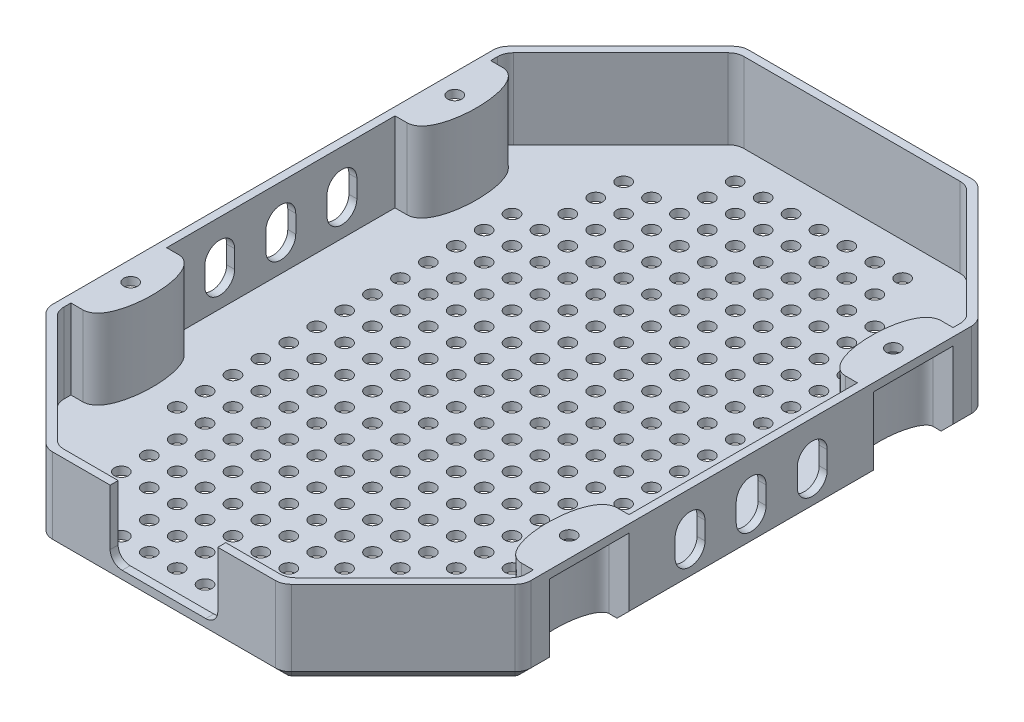
from build123d import *

# Parameters (mm, degrees)
BOSS_EXTRUDE1_DEPTH     = 2
BOSS_EXTRUDE2_DEPTH     = 20
BOSS_EXTRUDE3_DEPTH     = 2
SKETCH4_R               = 1.75
CUT_EXTRUDE1_DEPTH      = 108.810185667
SKETCH5_W               = 13.5
SKETCH5_H               = 2
CUT_EXTRUDE2_DEPTH      = 17
CUT_EXTRUDE3_DEPTH      = 109.199057916
FILLET1_R               = 3
FILLET2_R               = 4
CHAMFER1_SIZE           = 3
FILL_PATTERN1_OUTLINE_R = 1.75
FILL_PATTERN1_DEPTH     = 2


# Read off the part's stored shape, not the designer's step: Fill Pattern1
with BuildPart() as part:
    # Sketch1 → Boss-Extrude1 (new body)
    with BuildSketch(Plane(origin=(0, 0, 0), x_dir=(1, 0, 0), z_dir=(0, 1, 0))):
        with BuildLine():
            Line((55, 30.651951673), (60, 30.651951673))
            Line((60, 30.651951673), (60, -30.651951673))
            Line((60, -30.651951673), (55, -30.651951673))
            add(Edge.make_bspline(
                [(55, -30.651951673), (51.5, -30.651951673), (51.5, -40.651951673), (51.5, -50.651951673), (55, -50.651951673)],
                knots=[3.141592654, 3.141592654, 3.141592654, 4.71238898, 4.71238898, 6.283185307, 6.283185307, 6.283185307], degree=2, weights=[1, 0.707106781, 1, 0.707106781, 1]))
            Line((55, -50.651951673), (60, -50.651951673))
            Line((60, -50.651951673), (60, -56.904408409))
            Line((60, -56.904408409), (29.594408409, -87.31))
            Line((29.594408409, -87.31), (0, -87.31))
            Line((0, -87.31), (0, 87.31))
            Line((0, 87.31), (29.594408409, 87.31))
            Line((29.594408409, 87.31), (60, 56.904408409))
            Line((60, 56.904408409), (60, 50.651951673))
            Line((60, 50.651951673), (55, 50.651951673))
            add(Edge.make_bspline(
                [(55, 50.651951673), (51.5, 50.651951673), (51.5, 40.651951673), (51.5, 30.651951673), (55, 30.651951673)],
                knots=[0, 0, 0, 1.570796327, 1.570796327, 3.141592654, 3.141592654, 3.141592654], degree=2, weights=[1, 0.707106781, 1, 0.707106781, 1]))
        make_face()
    extrude(amount=BOSS_EXTRUDE1_DEPTH)

    # Sketch2 → Boss-Extrude2 (add)
    with BuildSketch(Plane(origin=(0, 2, 0), x_dir=(1, 0, 0), z_dir=(0, 1, 0))):
        with BuildLine():
            Line((29.594408409, 87.31), (0, 87.31))
            Line((0, 87.31), (0, 85.31))
            Line((0, 85.31), (28.765981284, 85.31))
            Line((28.765981284, 85.31), (58, 56.075981284))
            Line((58, 56.075981284), (58, 52.651951673))
            Line((58, 52.651951673), (55, 52.651951673))
            add(Edge.make_bspline(
                [(55, 28.651951673), (54.70222525, 28.651951673), (54.094873807, 28.739043927), (53.042573201, 29.199915612), (52.077202892, 30.084886092), (51.253226578, 31.371465347), (50.612948374, 32.884681085), (50.119437244, 34.610908381), (49.645142322, 37.151780185), (49.403238452, 40.651951673), (49.645142322, 44.152123161), (50.119437244, 46.692994964), (50.612948374, 48.419222261), (51.253226578, 49.932437998), (52.077202892, 51.219017254), (53.042573201, 52.103987733), (54.094873807, 52.564859419), (54.70222525, 52.651951673), (55, 52.651951673)],
                knots=[0, 0, 0, 0, 0.09817477, 0.196349541, 0.392699082, 0.589048623, 0.785398163, 0.981747704, 1.178097245, 1.570796327, 1.963495408, 2.159844949, 2.35619449, 2.552544031, 2.748893572, 2.945243113, 3.043417883, 3.141592654, 3.141592654, 3.141592654, 3.141592654], degree=3))
            Line((55, 28.651951673), (58, 28.651951673))
            Line((58, 28.651951673), (58, -28.651951673))
            Line((58, -28.651951673), (55, -28.651951673))
            add(Edge.make_bspline(
                [(55, -52.651951673), (54.70222525, -52.651951673), (54.094873807, -52.564859419), (53.042573201, -52.103987733), (52.077202892, -51.219017254), (51.253226578, -49.932437998), (50.612948374, -48.419222261), (50.119437244, -46.692994964), (49.645142322, -44.152123161), (49.403238452, -40.651951673), (49.645142322, -37.151780185), (50.119437244, -34.610908381), (50.612948374, -32.884681085), (51.253226578, -31.371465347), (52.077202892, -30.084886092), (53.042573201, -29.199915612), (54.094873807, -28.739043927), (54.70222525, -28.651951673), (55, -28.651951673)],
                knots=[3.141592654, 3.141592654, 3.141592654, 3.141592654, 3.239767424, 3.337942194, 3.534291735, 3.730641276, 3.926990817, 4.123340358, 4.319689899, 4.71238898, 5.105088062, 5.301437603, 5.497787144, 5.694136685, 5.890486225, 6.086835766, 6.185010537, 6.283185307, 6.283185307, 6.283185307, 6.283185307], degree=3))
            Line((55, -52.651951673), (58, -52.651951673))
            Line((58, -52.651951673), (58, -56.075981284))
            Line((58, -56.075981284), (28.765981284, -85.31))
            Line((28.765981284, -85.31), (0, -85.31))
            Line((0, -85.31), (0, -87.31))
            Line((0, -87.31), (29.594408409, -87.31))
            Line((29.594408409, -87.31), (60, -56.904408409))
            Line((60, -56.904408409), (60, -50.651951673))
            Line((60, -50.651951673), (55, -50.651951673))
            add(Edge.make_bspline(
                [(55, -30.651951673), (51.5, -30.651951673), (51.5, -40.651951673), (51.5, -50.651951673), (55, -50.651951673)],
                knots=[3.141592654, 3.141592654, 3.141592654, 4.71238898, 4.71238898, 6.283185307, 6.283185307, 6.283185307], degree=2, weights=[1, 0.707106781, 1, 0.707106781, 1]))
            Line((55, -30.651951673), (60, -30.651951673))
            Line((60, -30.651951673), (60, 30.651951673))
            Line((60, 30.651951673), (55, 30.651951673))
            add(Edge.make_bspline(
                [(55, 50.651951673), (51.5, 50.651951673), (51.5, 40.651951673), (51.5, 30.651951673), (55, 30.651951673)],
                knots=[0, 0, 0, 1.570796327, 1.570796327, 3.141592654, 3.141592654, 3.141592654], degree=2, weights=[1, 0.707106781, 1, 0.707106781, 1]))
            Line((55, 50.651951673), (60, 50.651951673))
            Line((60, 50.651951673), (60, 56.904408409))
            Line((60, 56.904408409), (29.594408409, 87.31))
        make_face()
    extrude(amount=BOSS_EXTRUDE2_DEPTH)

    # Sketch3 → Boss-Extrude3 (add)
    with BuildSketch(Plane(origin=(0, 22, 0), x_dir=(1, 0, 0), z_dir=(0, 1, 0))):
        with BuildLine():
            Line((60, 30.651951673), (55, 30.651951673))
            add(Edge.make_bspline(
                [(55, 50.651951673), (51.5, 50.651951673), (51.5, 40.651951673), (51.5, 30.651951673), (55, 30.651951673)],
                knots=[0, 0, 0, 1.570796327, 1.570796327, 3.141592654, 3.141592654, 3.141592654], degree=2, weights=[1, 0.707106781, 1, 0.707106781, 1]))
            Line((55, 50.651951673), (60, 50.651951673))
            Line((60, 50.651951673), (60, 30.651951673))
        make_face()
        with BuildLine():
            Line((55, -50.651951673), (60, -50.651951673))
            Line((60, -50.651951673), (60, -30.651951673))
            Line((60, -30.651951673), (55, -30.651951673))
            add(Edge.make_bspline(
                [(55, -30.651951673), (51.5, -30.651951673), (51.5, -40.651951673), (51.5, -50.651951673), (55, -50.651951673)],
                knots=[3.141592654, 3.141592654, 3.141592654, 4.71238898, 4.71238898, 6.283185307, 6.283185307, 6.283185307], degree=2, weights=[1, 0.707106781, 1, 0.707106781, 1]))
        make_face()
    extrude(amount=-BOSS_EXTRUDE3_DEPTH)

    # Sketch4 → Cut-Extrude1 (cut, through all)
    with BuildSketch(Plane.XZ.offset(-20)):
        with Locations(Location((55, 40.651951673, 0), (0, 0, 270))):
            Circle(SKETCH4_R)
        with Locations(Location((55, -40.651951673, 0), (0, 0, 90))):
            Circle(SKETCH4_R)
    extrude(amount=-CUT_EXTRUDE1_DEPTH, mode=Mode.SUBTRACT)

    # Sketch5 → Cut-Extrude2 (cut)
    with BuildSketch(Plane(origin=(0, 22, 0), x_dir=(1, 0, 0), z_dir=(0, 1, 0))):
        with Locations((6.75, -86.31)):
            Rectangle(SKETCH5_W, SKETCH5_H)
    extrude(amount=-CUT_EXTRUDE2_DEPTH, mode=Mode.SUBTRACT)

    # Sketch8 → Cut-Extrude3 (cut, through all)
    with BuildSketch(Plane(origin=(60, 0, 0), x_dir=(0, 0, -1), z_dir=(1, 0, 0))):
        with BuildLine():
            Line((-3.75, 8.75), (-3.75, 13.25))
            ThreePointArc((-3.75, 13.25), (0, 17), (3.75, 13.25))
            Line((3.75, 13.25), (3.75, 8.75))
            ThreePointArc((3.75, 8.75), (0, 5), (-3.75, 8.75))
        make_face()
        with BuildLine():
            Line((11.575975836, 8.75), (11.575975836, 13.25))
            ThreePointArc((11.575975836, 13.25), (15.325975836, 17), (19.075975836, 13.25))
            Line((19.075975836, 13.25), (19.075975836, 8.75))
            ThreePointArc((19.075975836, 8.75), (15.325975836, 5), (11.575975836, 8.75))
        make_face()
        with BuildLine():
            Line((-19.075975836, 8.75), (-19.075975836, 13.25))
            ThreePointArc((-19.075975836, 13.25), (-15.325975836, 17), (-11.575975836, 13.25))
            Line((-11.575975836, 13.25), (-11.575975836, 8.75))
            ThreePointArc((-11.575975836, 8.75), (-15.325975836, 5), (-19.075975836, 8.75))
        make_face()
    extrude(amount=-CUT_EXTRUDE3_DEPTH, mode=Mode.SUBTRACT)

    # Fillet1
    fillet1_edges = [part.edges().sort_by_distance(p)[0] for p in [
        (13.5, 5, 86.31),
    ]]
    fillet(fillet1_edges, radius=FILLET1_R)

    # Fillet2
    fillet2_edges = [part.edges().sort_by_distance(p)[0] for p in [
        (60, 11, 56.904408409),
        (29.594408409, 11, 87.31),
        (29.594408409, 11, -87.31),
        (60, 11, -56.904408409),
        (28.765981284, 12, -85.31),
        (58, 12, -56.075981284),
        (58, 12, 56.075981284),
        (28.765981284, 12, 85.31),
    ]]
    fillet(fillet2_edges, radius=FILLET2_R)

    # Chamfer1
    chamfer1_edges = [part.edges().sort_by_distance(p)[0] for p in [
        (60, 0, 0),
        (13.96877708, 0, 87.31),
        (60, 0, -52.949752916),
        (13.96877708, 0, -87.31),
        (60, 0, 52.949752916),
        (44.797204204, 0, 72.107204204),
        (44.797204204, 0, -72.107204204),
        (29.468287889, 0, 87.00551813),
        (59.69551813, 0, 56.778287889),
        (59.69551813, 0, -56.778287889),
        (29.468287889, 0, -87.00551813),
    ]]
    chamfer(chamfer1_edges, length=CHAMFER1_SIZE)

    # Mirror1: part across plane


with BuildPart() as part_1:
    add(part.part)
    add(part.part.mirror(Plane(origin=(0, 0, 0), x_dir=(0, 0, 1), z_dir=(1, 0, 0))))

    # Fill Pattern1 outline → Fill Pattern1 (cut)
    with BuildSketch(Plane(origin=(0, 0, 0), x_dir=(1, 0, 0), z_dir=(0, 1, 0))):
        Circle(FILL_PATTERN1_OUTLINE_R)
        with Locations((21, -77)):
            Circle(FILL_PATTERN1_OUTLINE_R)
        with Locations((14, -77)):
            Circle(FILL_PATTERN1_OUTLINE_R)
        with Locations((7, -77)):
            Circle(FILL_PATTERN1_OUTLINE_R)
        with Locations((0, -77)):
            Circle(FILL_PATTERN1_OUTLINE_R)
        with Locations((-7, -77)):
            Circle(FILL_PATTERN1_OUTLINE_R)
        with Locations((-14, -77)):
            Circle(FILL_PATTERN1_OUTLINE_R)
        with Locations((-7, 56)):
            Circle(FILL_PATTERN1_OUTLINE_R)
        with Locations((0, 63)):
            Circle(FILL_PATTERN1_OUTLINE_R)
        with Locations((7, 70)):
            Circle(FILL_PATTERN1_OUTLINE_R)
        with Locations((14, 77)):
            Circle(FILL_PATTERN1_OUTLINE_R)
        with Locations((0, -14)):
            Circle(FILL_PATTERN1_OUTLINE_R)
        with Locations((-21, -7)):
            Circle(FILL_PATTERN1_OUTLINE_R)
        with Locations((-28, 14)):
            Circle(FILL_PATTERN1_OUTLINE_R)
        with Locations((-35, 35)):
            Circle(FILL_PATTERN1_OUTLINE_R)
        with Locations((-21, -14)):
            Circle(FILL_PATTERN1_OUTLINE_R)
        with Locations((7, -14)):
            Circle(FILL_PATTERN1_OUTLINE_R)
        with Locations((7, 77)):
            Circle(FILL_PATTERN1_OUTLINE_R)
        with Locations((0, 70)):
            Circle(FILL_PATTERN1_OUTLINE_R)
        with Locations((-7, 63)):
            Circle(FILL_PATTERN1_OUTLINE_R)
        with Locations((-14, 56)):
            Circle(FILL_PATTERN1_OUTLINE_R)
        with Locations((-21, 49)):
            Circle(FILL_PATTERN1_OUTLINE_R)
        with Locations((-28, 42)):
            Circle(FILL_PATTERN1_OUTLINE_R)
        with Locations((-14, -14)):
            Circle(FILL_PATTERN1_OUTLINE_R)
        with Locations((-21, 7)):
            Circle(FILL_PATTERN1_OUTLINE_R)
        with Locations((-28, 28)):
            Circle(FILL_PATTERN1_OUTLINE_R)
        with Locations((-21, 35)):
            Circle(FILL_PATTERN1_OUTLINE_R)
        with Locations((-14, 42)):
            Circle(FILL_PATTERN1_OUTLINE_R)
        with Locations((-7, 49)):
            Circle(FILL_PATTERN1_OUTLINE_R)
        with Locations((0, 56)):
            Circle(FILL_PATTERN1_OUTLINE_R)
        with Locations((7, 63)):
            Circle(FILL_PATTERN1_OUTLINE_R)
        with Locations((-14, 49)):
            Circle(FILL_PATTERN1_OUTLINE_R)
        with Locations((-21, 42)):
            Circle(FILL_PATTERN1_OUTLINE_R)
        with Locations((-28, 35)):
            Circle(FILL_PATTERN1_OUTLINE_R)
        with Locations((-28, 21)):
            Circle(FILL_PATTERN1_OUTLINE_R)
        with Locations((-21, 0)):
            Circle(FILL_PATTERN1_OUTLINE_R)
        with Locations((-7, -14)):
            Circle(FILL_PATTERN1_OUTLINE_R)
        with Locations((21, 77)):
            Circle(FILL_PATTERN1_OUTLINE_R)
        with Locations((14, 70)):
            Circle(FILL_PATTERN1_OUTLINE_R)
        with Locations((-14, 70)):
            Circle(FILL_PATTERN1_OUTLINE_R)
        with Locations((-7, 77)):
            Circle(FILL_PATTERN1_OUTLINE_R)
        with Locations((14, -7)):
            Circle(FILL_PATTERN1_OUTLINE_R)
        with Locations((-14, -21)):
            Circle(FILL_PATTERN1_OUTLINE_R)
        with Locations((-28, -7)):
            Circle(FILL_PATTERN1_OUTLINE_R)
        with Locations((-35, 14)):
            Circle(FILL_PATTERN1_OUTLINE_R)
        with Locations((-42, 35)):
            Circle(FILL_PATTERN1_OUTLINE_R)
        with Locations((-35, 56)):
            Circle(FILL_PATTERN1_OUTLINE_R)
        with Locations((-42, 28)):
            Circle(FILL_PATTERN1_OUTLINE_R)
        with Locations((-35, 7)):
            Circle(FILL_PATTERN1_OUTLINE_R)
        with Locations((-28, -14)):
            Circle(FILL_PATTERN1_OUTLINE_R)
        with Locations((-7, -21)):
            Circle(FILL_PATTERN1_OUTLINE_R)
        with Locations((14, 0)):
            Circle(FILL_PATTERN1_OUTLINE_R)
        with Locations((-14, 77)):
            Circle(FILL_PATTERN1_OUTLINE_R)
        with Locations((-21, 70)):
            Circle(FILL_PATTERN1_OUTLINE_R)
        with Locations((-28, 63)):
            Circle(FILL_PATTERN1_OUTLINE_R)
        with Locations((-28, 7)):
            Circle(FILL_PATTERN1_OUTLINE_R)
        with Locations((-35, 28)):
            Circle(FILL_PATTERN1_OUTLINE_R)
        with Locations((-35, 42)):
            Circle(FILL_PATTERN1_OUTLINE_R)
        with Locations((-28, 49)):
            Circle(FILL_PATTERN1_OUTLINE_R)
        with Locations((-21, 56)):
            Circle(FILL_PATTERN1_OUTLINE_R)
        with Locations((-14, 63)):
            Circle(FILL_PATTERN1_OUTLINE_R)
        with Locations((-7, 70)):
            Circle(FILL_PATTERN1_OUTLINE_R)
        with Locations((0, 77)):
            Circle(FILL_PATTERN1_OUTLINE_R)
        with Locations((14, -14)):
            Circle(FILL_PATTERN1_OUTLINE_R)
        with Locations((-21, -21)):
            Circle(FILL_PATTERN1_OUTLINE_R)
        with Locations((-28, 0)):
            Circle(FILL_PATTERN1_OUTLINE_R)
        with Locations((-35, 21)):
            Circle(FILL_PATTERN1_OUTLINE_R)
        with Locations((-42, 42)):
            Circle(FILL_PATTERN1_OUTLINE_R)
        with Locations((-35, 49)):
            Circle(FILL_PATTERN1_OUTLINE_R)
        with Locations((-28, 56)):
            Circle(FILL_PATTERN1_OUTLINE_R)
        with Locations((-21, 63)):
            Circle(FILL_PATTERN1_OUTLINE_R)
        with Locations((14, 35)):
            Circle(FILL_PATTERN1_OUTLINE_R)
        with Locations((7, 28)):
            Circle(FILL_PATTERN1_OUTLINE_R)
        with Locations((0, 21)):
            Circle(FILL_PATTERN1_OUTLINE_R)
        with Locations((-7, 14)):
            Circle(FILL_PATTERN1_OUTLINE_R)
        with Locations((21, 35)):
            Circle(FILL_PATTERN1_OUTLINE_R)
        with Locations((28, 42)):
            Circle(FILL_PATTERN1_OUTLINE_R)
        with Locations((35, 49)):
            Circle(FILL_PATTERN1_OUTLINE_R)
        with Locations((-7, 0)):
            Circle(FILL_PATTERN1_OUTLINE_R)
        with Locations((7, 35)):
            Circle(FILL_PATTERN1_OUTLINE_R)
        with Locations((0, 28)):
            Circle(FILL_PATTERN1_OUTLINE_R)
        with Locations((-7, 21)):
            Circle(FILL_PATTERN1_OUTLINE_R)
        with Locations((-14, 14)):
            Circle(FILL_PATTERN1_OUTLINE_R)
        with Locations((21, 42)):
            Circle(FILL_PATTERN1_OUTLINE_R)
        with Locations((28, 49)):
            Circle(FILL_PATTERN1_OUTLINE_R)
        with Locations((35, 56)):
            Circle(FILL_PATTERN1_OUTLINE_R)
        with Locations((-7, -7)):
            Circle(FILL_PATTERN1_OUTLINE_R)
        with Locations((7, 14)):
            Circle(FILL_PATTERN1_OUTLINE_R)
        with Locations((0, 7)):
            Circle(FILL_PATTERN1_OUTLINE_R)
        with Locations((42, 42)):
            Circle(FILL_PATTERN1_OUTLINE_R)
        with Locations((35, 35)):
            Circle(FILL_PATTERN1_OUTLINE_R)
        with Locations((28, 28)):
            Circle(FILL_PATTERN1_OUTLINE_R)
        with Locations((21, 21)):
            Circle(FILL_PATTERN1_OUTLINE_R)
        with Locations((14, 14)):
            Circle(FILL_PATTERN1_OUTLINE_R)
        with Locations((7, 7)):
            Circle(FILL_PATTERN1_OUTLINE_R)
        with Locations((14, 28)):
            Circle(FILL_PATTERN1_OUTLINE_R)
        with Locations((7, 21)):
            Circle(FILL_PATTERN1_OUTLINE_R)
        with Locations((0, 14)):
            Circle(FILL_PATTERN1_OUTLINE_R)
        with Locations((-7, 7)):
            Circle(FILL_PATTERN1_OUTLINE_R)
        with Locations((35, 42)):
            Circle(FILL_PATTERN1_OUTLINE_R)
        with Locations((28, 35)):
            Circle(FILL_PATTERN1_OUTLINE_R)
        with Locations((21, 28)):
            Circle(FILL_PATTERN1_OUTLINE_R)
        with Locations((14, 21)):
            Circle(FILL_PATTERN1_OUTLINE_R)
        with Locations((-14, -7)):
            Circle(FILL_PATTERN1_OUTLINE_R)
        with Locations((7, 0)):
            Circle(FILL_PATTERN1_OUTLINE_R)
        with Locations((21, 63)):
            Circle(FILL_PATTERN1_OUTLINE_R)
        with Locations((14, 56)):
            Circle(FILL_PATTERN1_OUTLINE_R)
        with Locations((7, 49)):
            Circle(FILL_PATTERN1_OUTLINE_R)
        with Locations((0, 42)):
            Circle(FILL_PATTERN1_OUTLINE_R)
        with Locations((-7, 35)):
            Circle(FILL_PATTERN1_OUTLINE_R)
        with Locations((-14, 28)):
            Circle(FILL_PATTERN1_OUTLINE_R)
        with Locations((-21, 14)):
            Circle(FILL_PATTERN1_OUTLINE_R)
        with Locations((-21, 28)):
            Circle(FILL_PATTERN1_OUTLINE_R)
        with Locations((-14, 35)):
            Circle(FILL_PATTERN1_OUTLINE_R)
        with Locations((-7, 42)):
            Circle(FILL_PATTERN1_OUTLINE_R)
        with Locations((0, 49)):
            Circle(FILL_PATTERN1_OUTLINE_R)
        with Locations((7, 56)):
            Circle(FILL_PATTERN1_OUTLINE_R)
        with Locations((14, 63)):
            Circle(FILL_PATTERN1_OUTLINE_R)
        with Locations((21, 70)):
            Circle(FILL_PATTERN1_OUTLINE_R)
        with Locations((14, 42)):
            Circle(FILL_PATTERN1_OUTLINE_R)
        with Locations((21, 49)):
            Circle(FILL_PATTERN1_OUTLINE_R)
        with Locations((28, 56)):
            Circle(FILL_PATTERN1_OUTLINE_R)
        with Locations((35, 63)):
            Circle(FILL_PATTERN1_OUTLINE_R)
        with Locations((0, -7)):
            Circle(FILL_PATTERN1_OUTLINE_R)
        with Locations((-14, 7)):
            Circle(FILL_PATTERN1_OUTLINE_R)
        with Locations((-14, 21)):
            Circle(FILL_PATTERN1_OUTLINE_R)
        with Locations((-7, 28)):
            Circle(FILL_PATTERN1_OUTLINE_R)
        with Locations((-21, 21)):
            Circle(FILL_PATTERN1_OUTLINE_R)
        with Locations((-14, 0)):
            Circle(FILL_PATTERN1_OUTLINE_R)
        with Locations((7, -7)):
            Circle(FILL_PATTERN1_OUTLINE_R)
        with Locations((28, 63)):
            Circle(FILL_PATTERN1_OUTLINE_R)
        with Locations((21, 56)):
            Circle(FILL_PATTERN1_OUTLINE_R)
        with Locations((14, 49)):
            Circle(FILL_PATTERN1_OUTLINE_R)
        with Locations((7, 42)):
            Circle(FILL_PATTERN1_OUTLINE_R)
        with Locations((0, 35)):
            Circle(FILL_PATTERN1_OUTLINE_R)
        with Locations((42, -28)):
            Circle(FILL_PATTERN1_OUTLINE_R)
        with Locations((35, 21)):
            Circle(FILL_PATTERN1_OUTLINE_R)
        with Locations((-21, -56)):
            Circle(FILL_PATTERN1_OUTLINE_R)
        with Locations((14, -49)):
            Circle(FILL_PATTERN1_OUTLINE_R)
        with Locations((42, -35)):
            Circle(FILL_PATTERN1_OUTLINE_R)
        with Locations((35, 14)):
            Circle(FILL_PATTERN1_OUTLINE_R)
        with Locations((-28, -56)):
            Circle(FILL_PATTERN1_OUTLINE_R)
        with Locations((7, -49)):
            Circle(FILL_PATTERN1_OUTLINE_R)
        with Locations((35, -49)):
            Circle(FILL_PATTERN1_OUTLINE_R)
        with Locations((42, -14)):
            Circle(FILL_PATTERN1_OUTLINE_R)
        with Locations((-7, -56)):
            Circle(FILL_PATTERN1_OUTLINE_R)
        with Locations((28, -49)):
            Circle(FILL_PATTERN1_OUTLINE_R)
        with Locations((42, -21)):
            Circle(FILL_PATTERN1_OUTLINE_R)
        with Locations((35, 28)):
            Circle(FILL_PATTERN1_OUTLINE_R)
        with Locations((-14, -56)):
            Circle(FILL_PATTERN1_OUTLINE_R)
        with Locations((21, -49)):
            Circle(FILL_PATTERN1_OUTLINE_R)
        with Locations((35, -14)):
            Circle(FILL_PATTERN1_OUTLINE_R)
        with Locations((21, -42)):
            Circle(FILL_PATTERN1_OUTLINE_R)
        with Locations((-14, -49)):
            Circle(FILL_PATTERN1_OUTLINE_R)
        with Locations((35, -7)):
            Circle(FILL_PATTERN1_OUTLINE_R)
        with Locations((-28, -49)):
            Circle(FILL_PATTERN1_OUTLINE_R)
        with Locations((35, -21)):
            Circle(FILL_PATTERN1_OUTLINE_R)
        with Locations((14, -42)):
            Circle(FILL_PATTERN1_OUTLINE_R)
        with Locations((-21, -49)):
            Circle(FILL_PATTERN1_OUTLINE_R)
        with Locations((42, -42)):
            Circle(FILL_PATTERN1_OUTLINE_R)
        with Locations((35, 7)):
            Circle(FILL_PATTERN1_OUTLINE_R)
        with Locations((-35, -56)):
            Circle(FILL_PATTERN1_OUTLINE_R)
        with Locations((0, -49)):
            Circle(FILL_PATTERN1_OUTLINE_R)
        with Locations((35, -42)):
            Circle(FILL_PATTERN1_OUTLINE_R)
        with Locations((35, 0)):
            Circle(FILL_PATTERN1_OUTLINE_R)
        with Locations((-7, -49)):
            Circle(FILL_PATTERN1_OUTLINE_R)
        with Locations((28, -42)):
            Circle(FILL_PATTERN1_OUTLINE_R)
        with Locations((14, -63)):
            Circle(FILL_PATTERN1_OUTLINE_R)
        with Locations((-21, -70)):
            Circle(FILL_PATTERN1_OUTLINE_R)
        with Locations((21, -63)):
            Circle(FILL_PATTERN1_OUTLINE_R)
        with Locations((-14, -70)):
            Circle(FILL_PATTERN1_OUTLINE_R)
        with Locations((0, -63)):
            Circle(FILL_PATTERN1_OUTLINE_R)
        with Locations((42, 28)):
            Circle(FILL_PATTERN1_OUTLINE_R)
        with Locations((7, -63)):
            Circle(FILL_PATTERN1_OUTLINE_R)
        with Locations((42, 35)):
            Circle(FILL_PATTERN1_OUTLINE_R)
        with Locations((7, -70)):
            Circle(FILL_PATTERN1_OUTLINE_R)
        with Locations((14, -70)):
            Circle(FILL_PATTERN1_OUTLINE_R)
        with Locations((-21, -77)):
            Circle(FILL_PATTERN1_OUTLINE_R)
        with Locations((21, -70)):
            Circle(FILL_PATTERN1_OUTLINE_R)
        with Locations((28, -63)):
            Circle(FILL_PATTERN1_OUTLINE_R)
        with Locations((-7, -70)):
            Circle(FILL_PATTERN1_OUTLINE_R)
        with Locations((35, -63)):
            Circle(FILL_PATTERN1_OUTLINE_R)
        with Locations((0, -70)):
            Circle(FILL_PATTERN1_OUTLINE_R)
        with Locations((-28, -63)):
            Circle(FILL_PATTERN1_OUTLINE_R)
        with Locations((42, 0)):
            Circle(FILL_PATTERN1_OUTLINE_R)
        with Locations((14, -56)):
            Circle(FILL_PATTERN1_OUTLINE_R)
        with Locations((-21, -63)):
            Circle(FILL_PATTERN1_OUTLINE_R)
        with Locations((7, -56)):
            Circle(FILL_PATTERN1_OUTLINE_R)
        with Locations((42, -7)):
            Circle(FILL_PATTERN1_OUTLINE_R)
        with Locations((-35, -63)):
            Circle(FILL_PATTERN1_OUTLINE_R)
        with Locations((0, -56)):
            Circle(FILL_PATTERN1_OUTLINE_R)
        with Locations((35, -56)):
            Circle(FILL_PATTERN1_OUTLINE_R)
        with Locations((42, 21)):
            Circle(FILL_PATTERN1_OUTLINE_R)
        with Locations((-7, -63)):
            Circle(FILL_PATTERN1_OUTLINE_R)
        with Locations((28, -56)):
            Circle(FILL_PATTERN1_OUTLINE_R)
        with Locations((42, 7)):
            Circle(FILL_PATTERN1_OUTLINE_R)
        with Locations((21, -56)):
            Circle(FILL_PATTERN1_OUTLINE_R)
        with Locations((-14, -63)):
            Circle(FILL_PATTERN1_OUTLINE_R)
        with Locations((42, 14)):
            Circle(FILL_PATTERN1_OUTLINE_R)
        with Locations((21, -7)):
            Circle(FILL_PATTERN1_OUTLINE_R)
        with Locations((-42, -7)):
            Circle(FILL_PATTERN1_OUTLINE_R)
        with Locations((-35, -28)):
            Circle(FILL_PATTERN1_OUTLINE_R)
        with Locations((-7, -28)):
            Circle(FILL_PATTERN1_OUTLINE_R)
        with Locations((21, -14)):
            Circle(FILL_PATTERN1_OUTLINE_R)
        with Locations((-42, 0)):
            Circle(FILL_PATTERN1_OUTLINE_R)
        with Locations((-35, -21)):
            Circle(FILL_PATTERN1_OUTLINE_R)
        with Locations((-14, -28)):
            Circle(FILL_PATTERN1_OUTLINE_R)
        with Locations((21, 7)):
            Circle(FILL_PATTERN1_OUTLINE_R)
        with Locations((-42, -21)):
            Circle(FILL_PATTERN1_OUTLINE_R)
        with Locations((-28, -35)):
            Circle(FILL_PATTERN1_OUTLINE_R)
        with Locations((7, -28)):
            Circle(FILL_PATTERN1_OUTLINE_R)
        with Locations((21, 0)):
            Circle(FILL_PATTERN1_OUTLINE_R)
        with Locations((-42, -14)):
            Circle(FILL_PATTERN1_OUTLINE_R)
        with Locations((-35, -35)):
            Circle(FILL_PATTERN1_OUTLINE_R)
        with Locations((0, -28)):
            Circle(FILL_PATTERN1_OUTLINE_R)
        with Locations((-28, -21)):
            Circle(FILL_PATTERN1_OUTLINE_R)
        with Locations((-35, 0)):
            Circle(FILL_PATTERN1_OUTLINE_R)
        with Locations((-42, 21)):
            Circle(FILL_PATTERN1_OUTLINE_R)
        with Locations((7, -21)):
            Circle(FILL_PATTERN1_OUTLINE_R)
        with Locations((0, -21)):
            Circle(FILL_PATTERN1_OUTLINE_R)
        with Locations((14, 7)):
            Circle(FILL_PATTERN1_OUTLINE_R)
        with Locations((-21, 77)):
            Circle(FILL_PATTERN1_OUTLINE_R)
        with Locations((-35, 63)):
            Circle(FILL_PATTERN1_OUTLINE_R)
        with Locations((-21, -28)):
            Circle(FILL_PATTERN1_OUTLINE_R)
        with Locations((-35, -14)):
            Circle(FILL_PATTERN1_OUTLINE_R)
        with Locations((-42, 7)):
            Circle(FILL_PATTERN1_OUTLINE_R)
        with Locations((21, -21)):
            Circle(FILL_PATTERN1_OUTLINE_R)
        with Locations((-28, -28)):
            Circle(FILL_PATTERN1_OUTLINE_R)
        with Locations((-35, -7)):
            Circle(FILL_PATTERN1_OUTLINE_R)
        with Locations((-42, 14)):
            Circle(FILL_PATTERN1_OUTLINE_R)
        with Locations((14, -21)):
            Circle(FILL_PATTERN1_OUTLINE_R)
        with Locations((28, -35)):
            Circle(FILL_PATTERN1_OUTLINE_R)
        with Locations((28, 7)):
            Circle(FILL_PATTERN1_OUTLINE_R)
        with Locations((-14, -42)):
            Circle(FILL_PATTERN1_OUTLINE_R)
        with Locations((21, -35)):
            Circle(FILL_PATTERN1_OUTLINE_R)
        with Locations((28, -7)):
            Circle(FILL_PATTERN1_OUTLINE_R)
        with Locations((14, -35)):
            Circle(FILL_PATTERN1_OUTLINE_R)
        with Locations((-21, -42)):
            Circle(FILL_PATTERN1_OUTLINE_R)
        with Locations((28, 0)):
            Circle(FILL_PATTERN1_OUTLINE_R)
        with Locations((-35, -49)):
            Circle(FILL_PATTERN1_OUTLINE_R)
        with Locations((28, 21)):
            Circle(FILL_PATTERN1_OUTLINE_R)
        with Locations((35, -28)):
            Circle(FILL_PATTERN1_OUTLINE_R)
        with Locations((7, -42)):
            Circle(FILL_PATTERN1_OUTLINE_R)
        with Locations((-7, -42)):
            Circle(FILL_PATTERN1_OUTLINE_R)
        with Locations((28, 14)):
            Circle(FILL_PATTERN1_OUTLINE_R)
        with Locations((35, -35)):
            Circle(FILL_PATTERN1_OUTLINE_R)
        with Locations((0, -42)):
            Circle(FILL_PATTERN1_OUTLINE_R)
        with Locations((21, -28)):
            Circle(FILL_PATTERN1_OUTLINE_R)
        with Locations((-14, -35)):
            Circle(FILL_PATTERN1_OUTLINE_R)
        with Locations((-42, -35)):
            Circle(FILL_PATTERN1_OUTLINE_R)
        with Locations((28, -28)):
            Circle(FILL_PATTERN1_OUTLINE_R)
        with Locations((14, -28)):
            Circle(FILL_PATTERN1_OUTLINE_R)
        with Locations((-21, -35)):
            Circle(FILL_PATTERN1_OUTLINE_R)
        with Locations((-42, -28)):
            Circle(FILL_PATTERN1_OUTLINE_R)
        with Locations((21, 14)):
            Circle(FILL_PATTERN1_OUTLINE_R)
        with Locations((-35, -42)):
            Circle(FILL_PATTERN1_OUTLINE_R)
        with Locations((28, -14)):
            Circle(FILL_PATTERN1_OUTLINE_R)
        with Locations((7, -35)):
            Circle(FILL_PATTERN1_OUTLINE_R)
        with Locations((-28, -42)):
            Circle(FILL_PATTERN1_OUTLINE_R)
        with Locations((0, -35)):
            Circle(FILL_PATTERN1_OUTLINE_R)
        with Locations((28, -21)):
            Circle(FILL_PATTERN1_OUTLINE_R)
        with Locations((-42, -42)):
            Circle(FILL_PATTERN1_OUTLINE_R)
        with Locations((-7, -35)):
            Circle(FILL_PATTERN1_OUTLINE_R)
    extrude(amount=FILL_PATTERN1_DEPTH, mode=Mode.SUBTRACT)


solid = part_1.part
